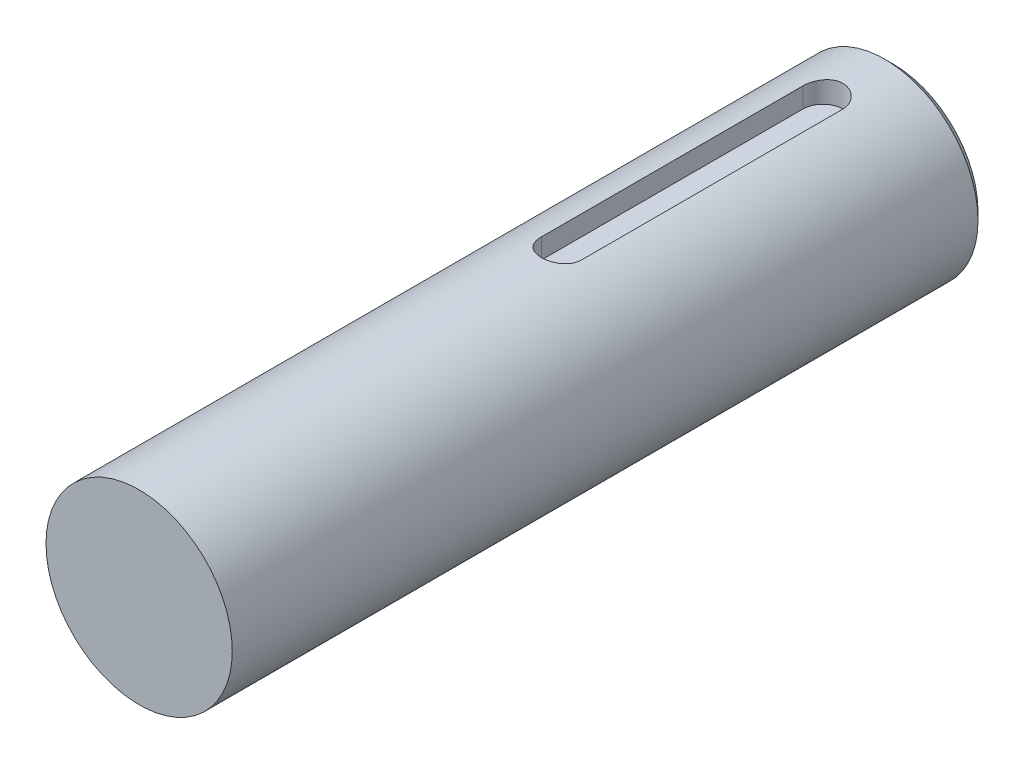
from build123d import *

# Parameters (mm, degrees)
SZKIC1_R                    = 11.115
DODANIE_WYCI_GNI_CIE1_DEPTH = 90
SFAZOWANIE1_SIZE            = 1
WYTNIJ_WYCI_GNI_CIE1_DEPTH  = 36
ZAOKR_GLENIE1_R             = 2.39
ZAOKR_GLENIE2_R             = 2.39


with BuildPart() as part:
    # Szkic1 → Dodanie-wyciągnięcie1 (new body)
    with BuildSketch(Plane.XY):
        with Locations(Location((0, 0, 0), (0, 0, 180))):
            Circle(SZKIC1_R)
    extrude(amount=DODANIE_WYCI_GNI_CIE1_DEPTH)

    # Sfazowanie1
    sfazowanie1_edges = [part.edges().sort_by_distance(p)[0] for p in [
        (11.115, 0, 0),
    ]]
    chamfer(sfazowanie1_edges, length=SFAZOWANIE1_SIZE)

    # Szkic2 → Wytnij-wyciągnięcie1 (cut)
    with BuildSketch(Plane(origin=(0, 0, 6), x_dir=(-1, 0, 0), z_dir=(0, 0, -1))):
        with BuildLine():
            Line((-2.39, 10.855004606), (-2.39, 8.465004606))
            Line((-2.39, 8.465004606), (2.39, 8.465004606))
            Line((2.39, 8.465004606), (2.39, 10.855004606))
            ThreePointArc((2.39, 10.855004606), (0, 11.115), (-2.39, 10.855004606))
        make_face()
    extrude(amount=-WYTNIJ_WYCI_GNI_CIE1_DEPTH, mode=Mode.SUBTRACT)

    # Zaokrąglenie1
    zaokr_glenie1_edges = [part.edges().sort_by_distance(p)[0] for p in [
        (-2.39, 9.660004606, 42),
        (2.39, 9.660004606, 42),
    ]]
    fillet(zaokr_glenie1_edges, radius=ZAOKR_GLENIE1_R - 0.0001)  # a hair under: the kernel refuses the full size

    # Zaokrąglenie2
    zaokr_glenie2_edges = [part.edges().sort_by_distance(p)[0] for p in [
        (2.39, 9.660004606, 6),
        (-2.39, 9.660004606, 6),
    ]]
    fillet(zaokr_glenie2_edges, radius=ZAOKR_GLENIE2_R - 0.0001)  # a hair under: the kernel refuses the full size


solid = part.part
